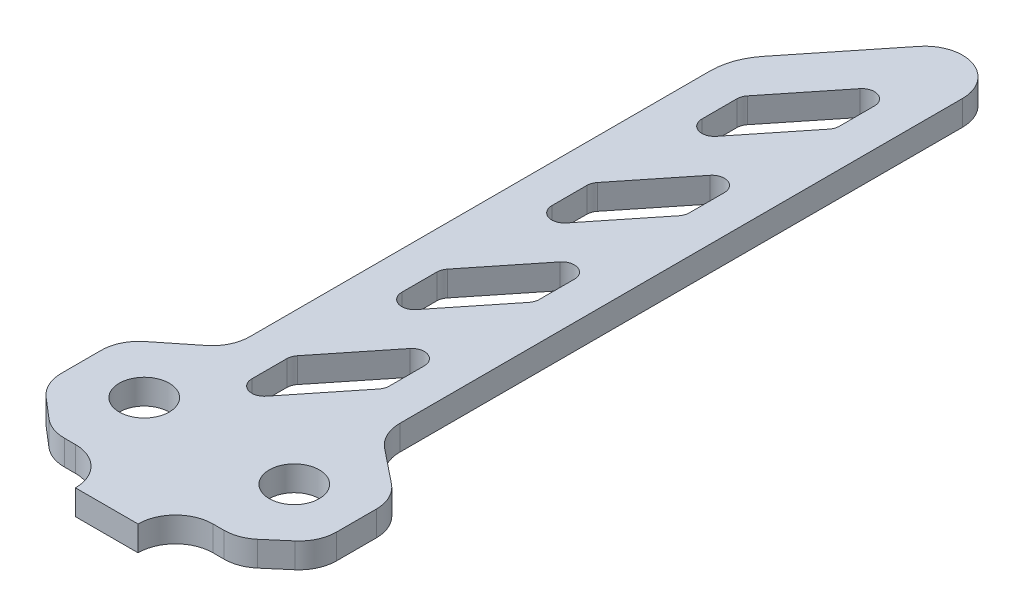
from build123d import *
from OCP.BRepFilletAPI import BRepFilletAPI_MakeFillet

# Parameters (mm, degrees)
BOSS_EXTRUDE1_DEPTH     = 1
CUT_EXTRUDE1_DEPTH      = 72.854018677
CUT_EXTRUDE2_DEPTH      = 72.854018677
CUT_EXTRUDE2_DEPTH_BACK = 72.854018677
SKETCH2_R               = 2
FILLET1_R               = 3
FILLET2_R               = 3
FILLET3_R1              = 5
FILLET3_R2              = 3
FILLET4_R               = 1
LPATTERN1_COUNT         = 4
LPATTERN1_PITCH         = 12
FILLET4_OF_LPATTERN1_R  = 1


with BuildPart() as part:
    # Sketch1 → Boss-Extrude1 (new, symmetric)
    with BuildSketch(Plane(origin=(0, 0, 0), x_dir=(1, 0, 0), z_dir=(0, 1, 0))):
        Polygon((-6, 56), (6, 71), (6, 16), (11, 12), (11, 6), (7.5, 3), (2.5, 3), (2.5, 0), (-2.5, 0), (-2.5, 3), (-7.5, 3), (-11, 6), (-11, 12), (-6, 16), align=None)
    extrude(amount=BOSS_EXTRUDE1_DEPTH, both=True)

    # Sketch1<3> → Cut-Extrude1 (cut, symmetric)
    with BuildSketch(Plane(origin=(0, 0, 0), x_dir=(1, 0, 0), z_dir=(0, 1, 0))):
        Polygon((3, 61.25), (-3, 53.75), (-3, 47.75), (3, 55.25), align=None)
    cut_extrude1 = extrude(amount=CUT_EXTRUDE1_DEPTH, both=True, mode=Mode.SUBTRACT)

    # Sketch2 → Cut-Extrude2 (cut, two sides: drawn at the far end of the back side and taken through both)
    with BuildSketch(Plane(origin=(0, 0, 0), x_dir=(1, 0, 0), z_dir=(0, 1, 0)).offset(-CUT_EXTRUDE2_DEPTH_BACK)):
        with Locations(Location((-6, 9, 0), (0, 0, 270))):
            Circle(SKETCH2_R)
        with Locations(Location((6, 9, 0), (0, 0, 270))):
            Circle(SKETCH2_R)
    extrude(amount=CUT_EXTRUDE2_DEPTH + CUT_EXTRUDE2_DEPTH_BACK, mode=Mode.SUBTRACT)

    # Fillet1
    fillet1_edges = [part.edges().sort_by_distance(p)[0] for p in [
        (2.5, 0, -3),
        (-2.5, 0, -3),
    ]]
    fillet(fillet1_edges, radius=FILLET1_R - 0.0001)  # a hair under: the kernel refuses the full size

    # Fillet2
    fillet2_edges = [part.edges().sort_by_distance(p)[0] for p in [
        (-6, 0, -16),
        (-11, 0, -12),
        (-11, 0, -6),
        (-7.5, 0, -3),
        (7.5, 0, -3),
        (11, 0, -6),
        (11, 0, -12),
        (6, 0, -16),
    ]]
    fillet(fillet2_edges, radius=FILLET2_R)

    # Fillet3: one fillet with a radius per group of edges: ONE call of the kernel's fillet builder (fillet() takes one radius for all edges)
    fillet3_edges_1 = [part.edges().sort_by_distance(p)[0] for p in [
        (-6, 0, -56),
    ]]
    fillet3_edges_2 = [part.edges().sort_by_distance(p)[0] for p in [
        (6, 0, -71),
    ]]
    fillet3 = BRepFilletAPI_MakeFillet(part.part.solid().wrapped)
    for e in fillet3_edges_1:
        fillet3.Add(FILLET3_R1, e.wrapped)
    for e in fillet3_edges_2:
        fillet3.Add(FILLET3_R2, e.wrapped)
    add(Compound.cast(fillet3.Shape()), mode=Mode.REPLACE)

    # Fillet4
    fillet4_edges = [part.edges().sort_by_distance(p)[0] for p in [
        (-3, 0, -47.75),
        (-3, 0, -53.75),
        (3, 0, -61.25),
        (3, 0, -55.25),
    ]]
    fillet(fillet4_edges, radius=FILLET4_R)

    # LPattern1: Cut-Extrude1 ×4
    with Locations(*[(0, 0, i * LPATTERN1_PITCH) for i in range(1, LPATTERN1_COUNT)]):
        add(cut_extrude1, mode=Mode.SUBTRACT)

    # Fillet4 of LPattern1
    fillet4_of_lpattern1_edges = [part.edges().sort_by_distance(p)[0] for p in [
        (-3, 0, -35.75),
        (-3, 0, -41.75),
        (3, 0, -49.25),
        (3, 0, -43.25),
        (-3, 0, -23.75),
        (-3, 0, -29.75),
        (3, 0, -37.25),
        (3, 0, -31.25),
        (-3, 0, -11.75),
        (-3, 0, -17.75),
        (3, 0, -25.25),
        (3, 0, -19.25),
    ]]
    fillet(fillet4_of_lpattern1_edges, radius=FILLET4_OF_LPATTERN1_R)


solid = part.part
